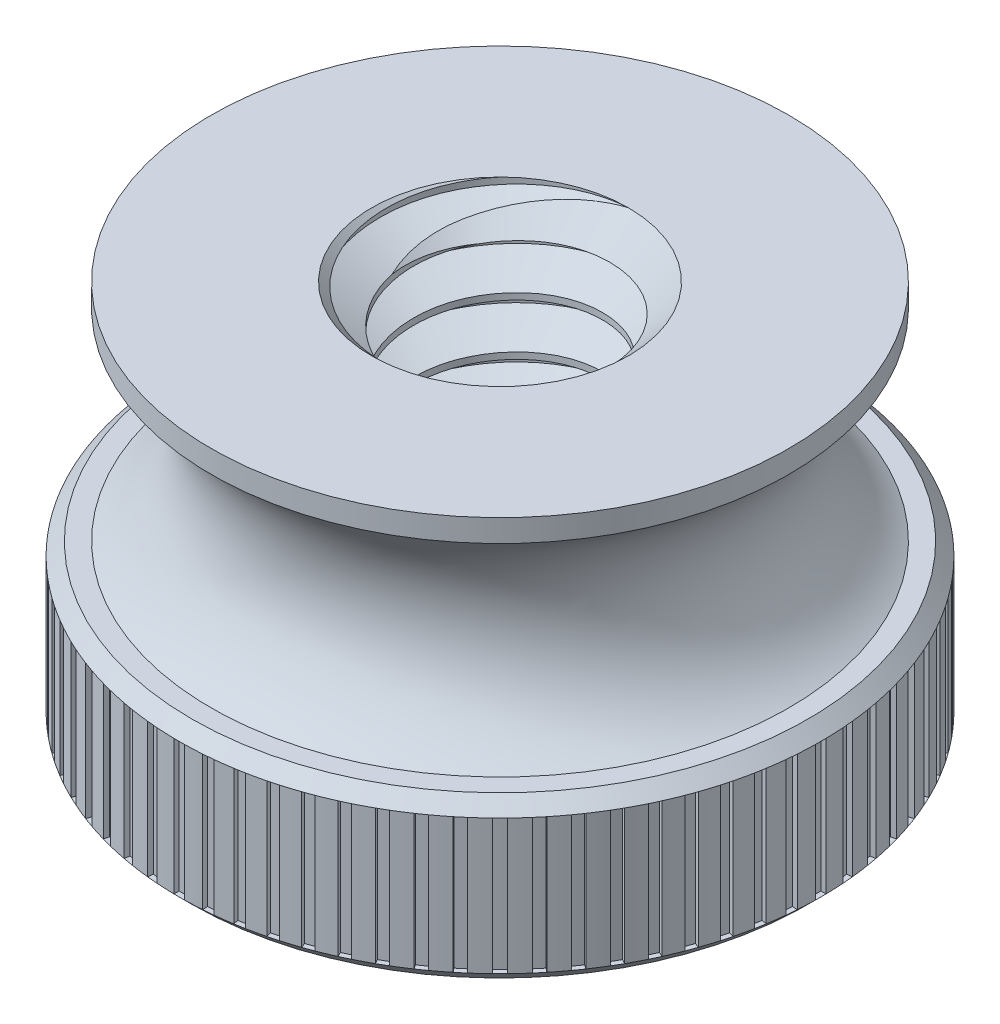
from build123d import *

# Parameters (mm, degrees)
SKETCH3_R               = 3.175
CUT_EXTRUDE1_DEPTH      = 15.721869362
SWEEP1_PITCH            = 1.27
SKETCH13_R              = 7.9375
CUT_EXTRUDE2_DEPTH      = 20.442966418
SKETCH14_R              = 7.9375
CUT_EXTRUDE3_DEPTH      = 15.721869534
CHAMFER1_SIZE           = 0.3175
CUT_EXTRUDE6_REACH      = 26.076
CUT_EXTRUDE6_END_RADIUS = 7.9375
SKETCH17_W              = 0.254
SKETCH17_H              = 3.33375
CIRPATTERN1_COUNT       = 72


with BuildPart() as part:
    # Sketch1 → Revolve1 (revolve)
    with BuildSketch(Plane.XY, mode=Mode.PRIVATE) as revolve1_sk:
        with BuildLine():
            Line((0, 9.525), (-7.14375, 9.525))
            Line((-7.14375, 9.525), (-7.14375, 8.969375))
            ThreePointArc((-7.14375, 8.969375), (-5.715, 6.4690625), (-7.14375, 3.96875))
            Line((-7.14375, 3.96875), (-7.9375, 3.96875))
            Line((-7.9375, 3.96875), (-7.9375, 0))
            Line((-7.9375, 0), (0, 0))
            Line((0, 0), (0, 9.525))
        make_face()
    revolve(revolve1_sk.sketch.rotate(Axis((0, 0, 0), (0, 1, 0)), 270), axis=Axis((0, 0, 0), (0, 1, 0)))

    # Sketch3 → Cut-Extrude1 (cut, through all)
    with BuildSketch(Plane(origin=(0, 0, 0), x_dir=(1, 0, 0), z_dir=(0, 1, 0))):
        with Locations(Location((0, 0, 0), (0, 0, 270))):
            Circle(SKETCH3_R)
    extrude(amount=CUT_EXTRUDE1_DEPTH, mode=Mode.SUBTRACT)

    # Sweep1: the profile of Sketch5 profile screwed along a left-hand helix of 12.5 turns, 6 arcs to a turn; built about Z, then put on its axis
    sweep1_z = Axis((0, 0, 0), (0, 0, 1))
    sweep1_corners = [(3.1753, 0, 0.000173205), (3.1753, 0, -1.111423205), (2.350110803, 0, -0.635), (2.350110803, 0, -0.47625)]
    with BuildLine(mode=Mode.PRIVATE) as sweep1_profile:
        Line(sweep1_corners[0], sweep1_corners[1])
        Line(sweep1_corners[1], sweep1_corners[2])
        Line(sweep1_corners[2], sweep1_corners[3])
        Line(sweep1_corners[3], sweep1_corners[0])
    sweep1_cap = Face(sweep1_profile.wire())
    sweep1_turn_angles = [0, -30, -60, -90, -120, -150, -180, -210, -240, -270, -300, -330, -360]
    sweep1_turn_weights = [1, 0.8660254037844387, 1, 0.8660254037844387, 1, 0.8660254037844387, 1, 0.8660254037844387, 1, 0.8660254037844387, 1, 0.8660254037844387, 1]
    sweep1_turn_rails = [Edge.make_bspline([Vector(p[0], p[1], 0).rotate(sweep1_z, sweep1_turn_angles[k]) / sweep1_turn_weights[k] + Vector(0, 0, p[2] + -SWEEP1_PITCH * sweep1_turn_angles[k] / 360) for k in range(13)], [0, 0, 0, 1, 1, 2, 2, 3, 3, 4, 4, 5, 5, 6, 6, 6], 2, sweep1_turn_weights) for p in sweep1_corners]
    sweep1_turn_sides = [Face.make_surface_from_curves(sweep1_turn_rails[p[0]], sweep1_turn_rails[p[1]]) for p in [(0, 1), (1, 2), (2, 3), (3, 0)]]
    sweep1_last_angles = [-4320, -4350, -4380, -4410, -4440, -4470, -4500]
    sweep1_last_weights = [1, 0.8660254037844387, 1, 0.8660254037844387, 1, 0.8660254037844228, 1]
    sweep1_last_rails = [Edge.make_bspline([Vector(p[0], p[1], 0).rotate(sweep1_z, sweep1_last_angles[k]) / sweep1_last_weights[k] + Vector(0, 0, p[2] + -SWEEP1_PITCH * sweep1_last_angles[k] / 360) for k in range(7)], [0, 0, 0, 1, 1, 2, 2, 3, 3, 3], 2, sweep1_last_weights) for p in sweep1_corners]
    sweep1_last_sides = [Face.make_surface_from_curves(sweep1_last_rails[p[0]], sweep1_last_rails[p[1]]) for p in [(0, 1), (1, 2), (2, 3), (3, 0)]]
    sweep1 = Plane(origin=(0, 0, 0), x_dir=(0, 0, 1), z_dir=(0, 1, 0)) * Solid(Shell([*[p.moved(Location((0, 0, SWEEP1_PITCH * i))) for i in range(12) for p in sweep1_turn_sides], *sweep1_last_sides, sweep1_cap, sweep1_cap.rotate(sweep1_z, -4500).moved(Location((0, 0, -SWEEP1_PITCH * -4500 / 360)))]))
    add(sweep1)

    # Sketch13 → Cut-Extrude2 (cut, through all)
    with BuildSketch(Plane.XZ):
        with Locations(Location((0, 0, 0), (0, 0, 270))):
            Circle(SKETCH13_R)
    extrude(amount=CUT_EXTRUDE2_DEPTH, mode=Mode.SUBTRACT)

    # Sketch14 → Cut-Extrude3 (cut, through all)
    with BuildSketch(Plane(origin=(0, 9.525, 0), x_dir=(1, 0, 0), z_dir=(0, 1, 0))):
        with Locations(Location((0, 0, 0), (0, 0, 90))):
            Circle(SKETCH14_R)
    extrude(amount=CUT_EXTRUDE3_DEPTH, mode=Mode.SUBTRACT)

    # Cut-Extrude4 cone 1 section (through the dimple's axis) → Cut-Extrude4 (revolve, cut)
    with BuildSketch(Plane(origin=(0, 0, 0), x_dir=(0, 0, -1), z_dir=(1, 0, 0))):
        Polygon((0, 0), (3.175, 0), (0, 3.175), align=None)
    revolve(axis=Axis((0, 0, 0), (0, 1, 0)), mode=Mode.SUBTRACT)

    # Cut-Extrude5 cone 1 section (through the dimple's axis) → Cut-Extrude5 (revolve, cut)
    with BuildSketch(Plane(origin=(0, 9.525, 0), x_dir=(0, 0, 1), z_dir=(1, 0, 0))):
        Polygon((0, 0), (3.175, 0), (0, 3.175), align=None)
    revolve(axis=Axis((0, 9.525, 0), (0, -1, 0)), mode=Mode.SUBTRACT)

    # Chamfer1
    chamfer1_edges = [part.edges().sort_by_distance(p)[0] for p in [
        (0, 0, 7.9375),
        (0, 3.96875, 7.9375),
    ]]
    chamfer(chamfer1_edges, length=CHAMFER1_SIZE)

    # Cut-Extrude6: up to this cylinder (the profile starts outside it)
    cut_extrude6_end = Plane(origin=(0, 1.984375, 0.127), z_dir=(0, -1, 0)) * Cylinder(CUT_EXTRUDE6_END_RADIUS, 69.027, mode=Mode.PRIVATE)
    # Sketch17 → Cut-Extrude6 (cut, up to the surface)
    with BuildSketch(Plane.XY.offset(-12.7), mode=Mode.PRIVATE) as cut_extrude6_sk1:
        with Locations((0, 1.984375)):
            Rectangle(SKETCH17_W, SKETCH17_H)
    cut_extrude6_tool1 = extrude(cut_extrude6_sk1.sketch, amount=CUT_EXTRUDE6_REACH, mode=Mode.PRIVATE) - cut_extrude6_end
    cut_extrude6 = cut_extrude6_tool1.solids().sort_by_distance((0, 1.984375, -12.7))[0]
    add(cut_extrude6, mode=Mode.SUBTRACT)

    # CirPattern1: Cut-Extrude6 ×72 about axis
    cirpattern1_axis = Axis((0, 0, 0), (0, 1, 0))
    for i in range(1, CIRPATTERN1_COUNT):
        add(cut_extrude6.rotate(cirpattern1_axis, i * 360 / CIRPATTERN1_COUNT), mode=Mode.SUBTRACT)


solid = part.part
